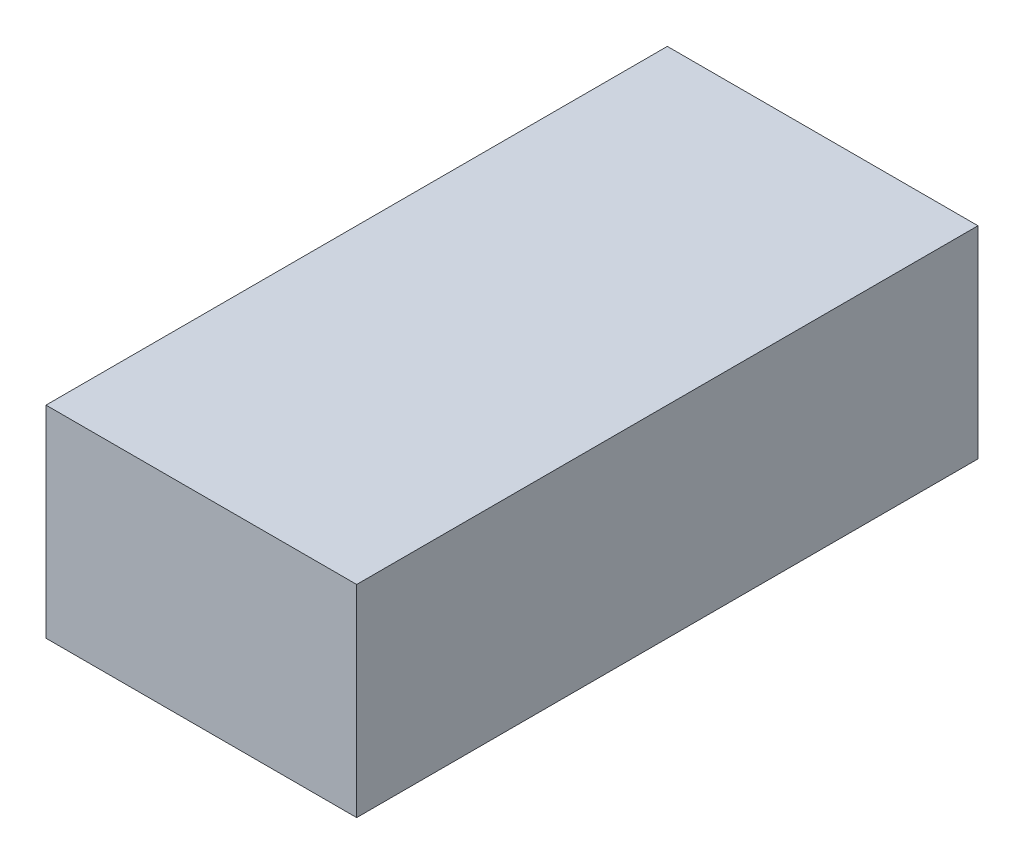
from build123d import *

# Parameters (mm, degrees)
SKETCH1_W           = 100
SKETCH1_H           = 200
BOSS_EXTRUDE1_DEPTH = 65


with BuildPart() as part:
    # Sketch1 → Boss-Extrude1 (new body)
    with BuildSketch(Plane(origin=(0, 0, 0), x_dir=(1, 0, 0), z_dir=(0, 1, 0))):
        with Locations((50, 100)):
            Rectangle(SKETCH1_W, SKETCH1_H)
    extrude(amount=BOSS_EXTRUDE1_DEPTH)


solid = part.part
